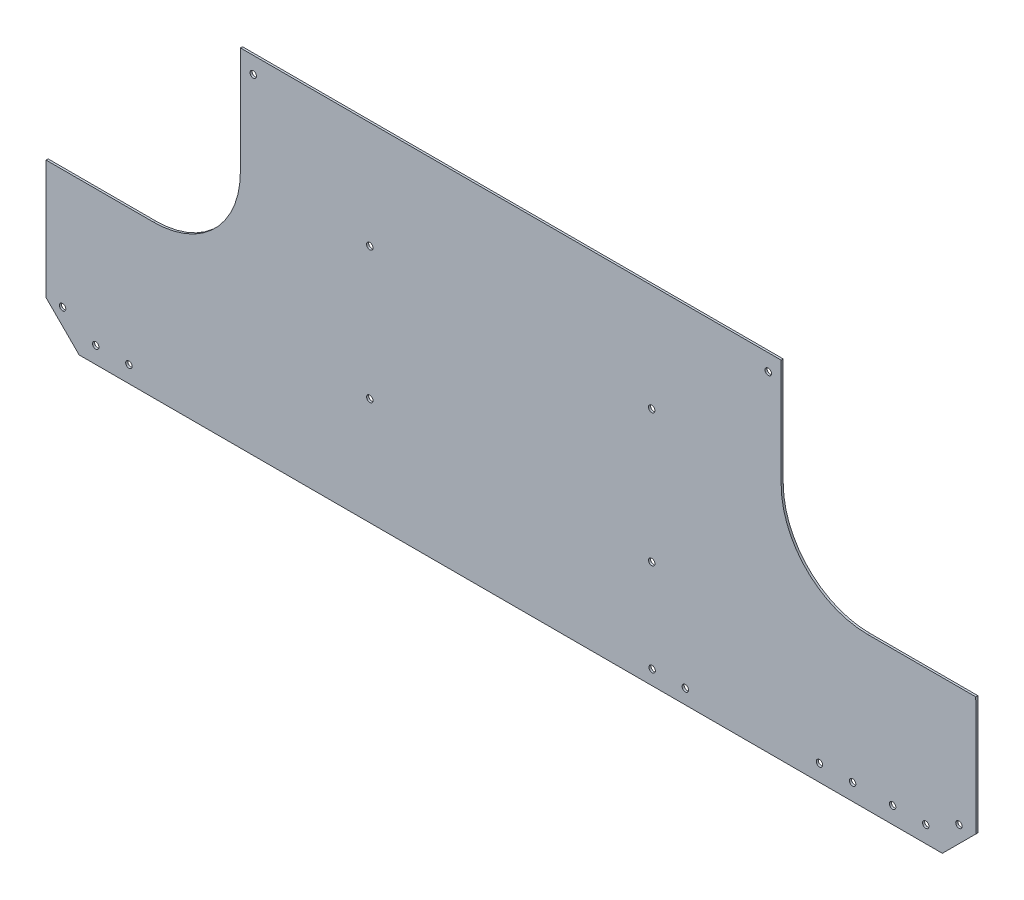
from build123d import *

# Parameters (mm, degrees)
SKETCH3_W                    = 914.4
SKETCH3_H                    = 609.6
BOSS_EXTRUDE1_DEPTH          = 0.79375
CUT_EXTRUDE1_DEPTH           = 2.54
CUT_EXTRUDE2_DEPTH           = 2.54
CUT_EXTRUDE3_DEPTH           = 2.54
F_10_0_1935_DIAMETER_HOLE1_D = 4.9149
F_10_0_1935_DIAMETER_HOLE2_D = 4.9149


with BuildPart() as part:
    # Sketch3 → Boss-Extrude1 (new, symmetric)
    with BuildSketch(Plane.XY):
        Rectangle(SKETCH3_W, SKETCH3_H)
    extrude(amount=BOSS_EXTRUDE1_DEPTH, both=True)

    # Sketch4 → Cut-Extrude1 (cut)
    with BuildSketch(Plane.XY.offset(0.79375)):
        Polygon((-378.246738216, -279.4), (-378.246738216, -39.370452154), (333.614037385, -39.370452154), (333.980724384, -279.084337387), (308.265061771, -304.8), (333.664461784, -304.8), (457.2, -304.8), (457.2, 304.8), (-457.2, 304.8), (-457.2, -304.8), (-378.246738216, -304.8), (-352.846738216, -304.8), align=None)
    extrude(amount=-CUT_EXTRUDE1_DEPTH, mode=Mode.SUBTRACT)

    # Sketch7 → Cut-Extrude2 (cut)
    with BuildSketch(Plane.XY.offset(0.79375)):
        with BuildLine():
            Line((-378.246738216, -188.190344021), (-378.246738216, -39.346344021))
            Line((-378.246738216, -39.346344021), (-229.402738216, -39.346344021))
            Line((-229.402738216, -39.346344021), (-229.402738216, -64.746344021))
            Line((-229.402738216, -64.746344021), (-229.402738216, -121.896344021))
            ThreePointArc((-229.402738216, -121.896344021), (-248.819801264, -168.773280973), (-295.696738216, -188.190344021))
            Line((-295.696738216, -188.190344021), (-352.846738216, -188.190344021))
            Line((-352.846738216, -188.190344021), (-378.246738216, -188.190344021))
        make_face()
    extrude(amount=-CUT_EXTRUDE2_DEPTH, mode=Mode.SUBTRACT)

    # Sketch8 → Cut-Extrude3 (cut)
    with BuildSketch(Plane.XY.offset(0.79375)):
        with BuildLine():
            Line((251.115061771, -188.190344021), (336.840061771, -188.190344021))
            Line((336.840061771, -188.190344021), (336.840061771, -36.171344021))
            Line((336.840061771, -36.171344021), (184.821061771, -36.171344021))
            Line((184.821061771, -36.171344021), (184.821061771, -121.896344021))
            ThreePointArc((184.821061771, -121.896344021), (204.238124819, -168.773280973), (251.115061771, -188.190344021))
        make_face()
    extrude(amount=-CUT_EXTRUDE3_DEPTH, mode=Mode.SUBTRACT)

    # #10 (0.1935) Diameter Hole1 (through all)
    with Locations(Plane.XY.offset(0.79375)):
        with Locations((-314.746738216, -292.114748821), (-340.146738216, -292.114748821), (-365.546738216, -279.414748821), (86.005546883, -293.702239208), (111.405546883, -293.702239208), (214.149530262, -292.114748821), (239.549530262, -292.114748821), (295.564461784, -292.114748821), (270.164461784, -292.114748821), (320.964461784, -279.414748821), (174.915061771, -52.046344021), (-219.496738216, -52.046344021)):
            Hole(F_10_0_1935_DIAMETER_HOLE1_D / 2)

    # #10 (0.1935) Diameter Hole2 (through all)
    with Locations(Plane.XY.offset(0.79375)):
        with Locations((-130.240838324, -121.273172039), (-130.240838324, -222.541034234), (85.659161879, -222.873171982), (85.659161879, -121.273172039)):
            Hole(F_10_0_1935_DIAMETER_HOLE2_D / 2)


solid = part.part
